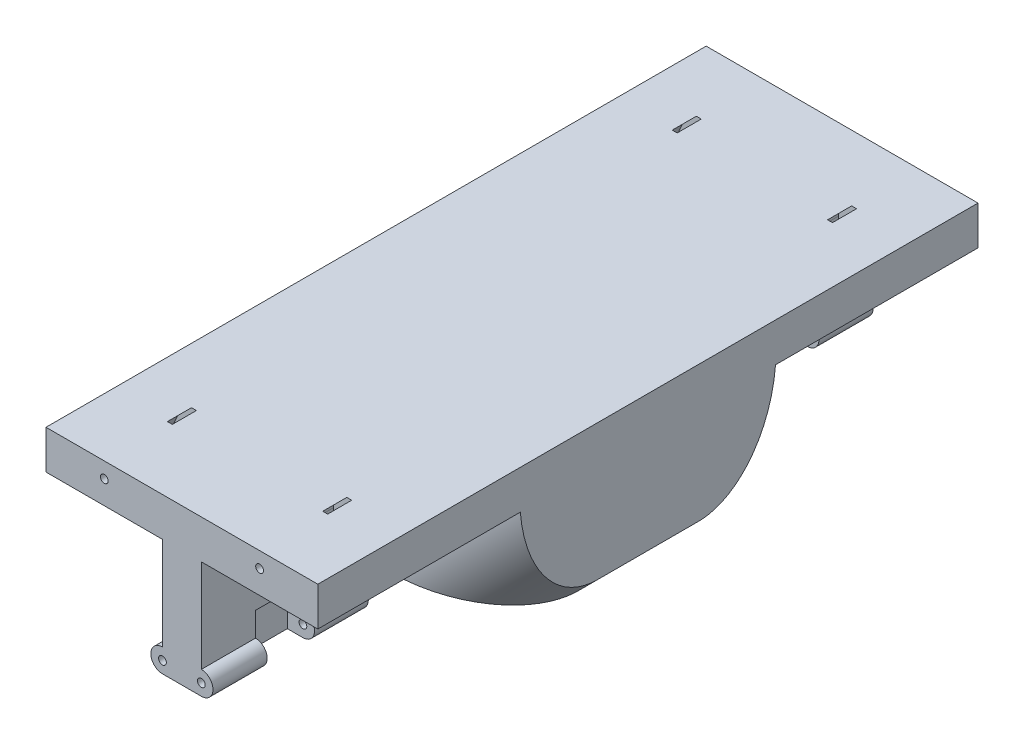
from build123d import *

# Parameters (mm, degrees)
SKETCH_1_W               = 70
SKETCH_1_H               = 40
EXTRUDE_1_DEPTH          = 85
SKETCH_7_W               = 30
SKETCH_7_H               = 30
CUT_EXTRUDE_5_DEPTH      = 52
SKETCH_4_R               = 3
EXTRUDE_3_DEPTH          = 40
SKETCH_5_W               = 12.2
SKETCH_5_H               = 12.2
CUT_EXTRUDE_3_DEPTH      = 4
SKETCH_6_R               = 1
CUT_EXTRUDE_4_DEPTH      = 40
MIRROR_2_COPY_1_SKETCH_W = 30
MIRROR_2_COPY_1_SKETCH_H = 30
MIRROR_2_COPY_1_DEPTH    = 52
MIRROR_2_COPY_2_SKETCH_R = 3
MIRROR_2_COPY_2_DEPTH    = 40
MIRROR_2_COPY_3_SKETCH_W = 12.2
MIRROR_2_COPY_3_SKETCH_H = 12.2
MIRROR_2_COPY_3_DEPTH    = 4
MIRROR_2_COPY_4_SKETCH_R = 1
MIRROR_2_COPY_4_DEPTH    = 40
MIRROR_2_COPY_5_SKETCH_W = 30
MIRROR_2_COPY_5_SKETCH_H = 30
MIRROR_2_COPY_5_DEPTH    = 52
MIRROR_2_COPY_6_SKETCH_R = 3
MIRROR_2_COPY_6_DEPTH    = 40
MIRROR_2_COPY_7_SKETCH_W = 12.2
MIRROR_2_COPY_7_SKETCH_H = 12.2
MIRROR_2_COPY_7_DEPTH    = 4
MIRROR_2_COPY_8_SKETCH_R = 1
MIRROR_2_COPY_8_DEPTH    = 40
CUT_EXTRUDE_8_REACH      = 126.742
SKETCH_13_R              = 1
CUT_EXTRUDE_11_DEPTH     = 40
SKETCH_14_R              = 1
CUT_EXTRUDE_12_DEPTH     = 3.1
FILLET_1_R               = 20
MIRROR_6_COPY_1_SKETCH_R = 1
MIRROR_6_COPY_1_DEPTH    = 40
MIRROR_6_COPY_2_SKETCH_R = 1
MIRROR_6_COPY_2_DEPTH    = 3.1


with BuildPart() as part:
    # Эскиз1 → Бобышка-Вытянуть1 (new, symmetric)
    with BuildSketch(Plane.XY):
        with Locations((0, -0.287208972)):
            Rectangle(SKETCH_1_W, SKETCH_1_H)
    extrude(amount=EXTRUDE_1_DEPTH, both=True)

    # Эскиз7 → Вырез-Вытянуть5 (cut)
    with BuildSketch(Plane.XY.offset(85)):
        with Locations((-20, -5.287208972)):
            Rectangle(SKETCH_7_W, SKETCH_7_H)
    cut_extrude_5 = extrude(amount=-CUT_EXTRUDE_5_DEPTH, mode=Mode.SUBTRACT)

    # Эскиз4 → Бобышка-Вытянуть3 (add)
    with BuildSketch(Plane.XY.offset(85)):
        with Locations((-5, -17.287208972)):
            Circle(SKETCH_4_R)
    extrude_3 = extrude(amount=-EXTRUDE_3_DEPTH)

    # Эскиз5 → Вырез-Вытянуть3 (cut, symmetric)
    with BuildSketch(Plane.ZY.offset(5)):
        with Locations((64.95, -14.187208972)):
            Rectangle(SKETCH_5_W, SKETCH_5_H)
    cut_extrude_3 = extrude(amount=CUT_EXTRUDE_3_DEPTH, both=True, mode=Mode.SUBTRACT)

    # Эскиз6 → Вырез-Вытянуть4 (cut)
    with BuildSketch(Plane.XY.offset(85)):
        with Locations((-5, -17.287208972)):
            Circle(SKETCH_6_R)
    cut_extrude_4 = extrude(amount=-CUT_EXTRUDE_4_DEPTH, mode=Mode.SUBTRACT)

    # Зеркальное отражение1: Вырез-Вытянуть5, Бобышка-Вытянуть3, Вырез-Вытянуть3, Вырез-Вытянуть4 across plane
    add(cut_extrude_5.mirror(Plane.XY), mode=Mode.SUBTRACT)
    add(extrude_3.mirror(Plane.XY))
    add(cut_extrude_3.mirror(Plane.XY), mode=Mode.SUBTRACT)
    add(cut_extrude_4.mirror(Plane.XY), mode=Mode.SUBTRACT)

    # Зеркальное отражение2 copy 1 sketch → Зеркальное отражение2 copy 1 (cut)
    with BuildSketch(Plane(origin=(0, 0, -85), x_dir=(-1, 0, 0), z_dir=(0, 0, -1))):
        with Locations((-20, -5.287208972)):
            Rectangle(MIRROR_2_COPY_1_SKETCH_W, MIRROR_2_COPY_1_SKETCH_H)
    extrude(amount=-MIRROR_2_COPY_1_DEPTH, mode=Mode.SUBTRACT)

    # Зеркальное отражение2 copy 2 sketch → Зеркальное отражение2 copy 2 (add)
    with BuildSketch(Plane(origin=(0, 0, -85), x_dir=(-1, 0, 0), z_dir=(0, 0, -1))):
        with Locations((-5, -17.287208972)):
            Circle(MIRROR_2_COPY_2_SKETCH_R)
    extrude(amount=-MIRROR_2_COPY_2_DEPTH)

    # Зеркальное отражение2 copy 3 sketch → Зеркальное отражение2 copy 3 (cut, symmetric)
    with BuildSketch(Plane(origin=(5, 0, 0), x_dir=(0, 0, -1), z_dir=(1, 0, 0))):
        with Locations((64.95, -14.187208972)):
            Rectangle(MIRROR_2_COPY_3_SKETCH_W, MIRROR_2_COPY_3_SKETCH_H)
    extrude(amount=MIRROR_2_COPY_3_DEPTH, both=True, mode=Mode.SUBTRACT)

    # Зеркальное отражение2 copy 4 sketch → Зеркальное отражение2 copy 4 (cut)
    with BuildSketch(Plane(origin=(0, 0, -85), x_dir=(-1, 0, 0), z_dir=(0, 0, -1))):
        with Locations((-5, -17.287208972)):
            Circle(MIRROR_2_COPY_4_SKETCH_R)
    extrude(amount=-MIRROR_2_COPY_4_DEPTH, mode=Mode.SUBTRACT)

    # Зеркальное отражение2 copy 5 sketch → Зеркальное отражение2 copy 5 (cut)
    with BuildSketch(Plane(origin=(0, 0, 85), x_dir=(-1, 0, 0), z_dir=(0, 0, 1))):
        with Locations((-20, 5.287208972)):
            Rectangle(MIRROR_2_COPY_5_SKETCH_W, MIRROR_2_COPY_5_SKETCH_H)
    extrude(amount=-MIRROR_2_COPY_5_DEPTH, mode=Mode.SUBTRACT)

    # Зеркальное отражение2 copy 6 sketch → Зеркальное отражение2 copy 6 (add)
    with BuildSketch(Plane(origin=(0, 0, 85), x_dir=(-1, 0, 0), z_dir=(0, 0, 1))):
        with Locations((-5, 17.287208972)):
            Circle(MIRROR_2_COPY_6_SKETCH_R)
    extrude(amount=-MIRROR_2_COPY_6_DEPTH)

    # Зеркальное отражение2 copy 7 sketch → Зеркальное отражение2 copy 7 (cut, symmetric)
    with BuildSketch(Plane(origin=(5, 0, 0), x_dir=(0, 0, 1), z_dir=(1, 0, 0))):
        with Locations((64.95, 14.187208972)):
            Rectangle(MIRROR_2_COPY_7_SKETCH_W, MIRROR_2_COPY_7_SKETCH_H)
    extrude(amount=MIRROR_2_COPY_7_DEPTH, both=True, mode=Mode.SUBTRACT)

    # Зеркальное отражение2 copy 8 sketch → Зеркальное отражение2 copy 8 (cut)
    with BuildSketch(Plane(origin=(0, 0, 85), x_dir=(-1, 0, 0), z_dir=(0, 0, 1))):
        with Locations((-5, 17.287208972)):
            Circle(MIRROR_2_COPY_8_SKETCH_R)
    extrude(amount=-MIRROR_2_COPY_8_DEPTH, mode=Mode.SUBTRACT)

    # Эскиз10 → Вырез-Вытянуть8 (cut, up to next)
    with BuildSketch(Plane.XY.offset(33), mode=Mode.PRIVATE) as cut_extrude_8_sk1:
        Polygon((35, -15.287208972), (30, -20.287208972), (35, -20.287208972), align=None)
    cut_extrude_8_tool1 = extrude(cut_extrude_8_sk1.sketch, amount=-CUT_EXTRUDE_8_REACH, mode=Mode.PRIVATE) & part.part
    # Эскиз10 → Вырез-Вытянуть8 (cut, up to next)
    with BuildSketch(Plane.XY.offset(33), mode=Mode.PRIVATE) as cut_extrude_8_sk2:
        Polygon((-30, -20.287208972), (-35, -15.287208972), (-35, -20.287208972), align=None)
    cut_extrude_8_tool2 = extrude(cut_extrude_8_sk2.sketch, amount=-CUT_EXTRUDE_8_REACH, mode=Mode.PRIVATE) & part.part
    add(cut_extrude_8_tool1.solids().sort_by_distance((33.333333, -18.620542, 33))[0], mode=Mode.SUBTRACT)
    add(cut_extrude_8_tool2.solids().sort_by_distance((-33.333333, -18.620542, 33))[0], mode=Mode.SUBTRACT)

    # Эскиз13 → Вырез-Вытянуть11 (cut)
    with BuildSketch(Plane.XY.offset(85)):
        with Locations((-20, 15.712791028)):
            Circle(SKETCH_13_R)
        with Locations((20, 15.712791028)):
            Circle(SKETCH_13_R)
    cut_extrude_11 = extrude(amount=-CUT_EXTRUDE_11_DEPTH, mode=Mode.SUBTRACT)

    # Эскиз14 → Вырез-Вытянуть12 (cut, symmetric)
    with BuildSketch(Plane.XY.offset(65)):
        with BuildLine():
            Line((-27, 9.712791028), (-15.95, 9.712791028))
            Line((-15.95, 9.712791028), (-15.95, 15.712791028))
            ThreePointArc((-15.95, 15.712791028), (-19.180771204, 19.679069407), (-23.718574904, 17.317378416))
            Line((-23.718574904, 17.317378416), (-27, 9.712791028))
        make_face()
        with Locations((-20, 15.712791028)):
            Circle(SKETCH_14_R, mode=Mode.SUBTRACT)
    cut_extrude_12 = extrude(amount=CUT_EXTRUDE_12_DEPTH, both=True, mode=Mode.SUBTRACT)

    # Скругление1
    fillet_1_edges = [part.edges().sort_by_distance(p)[0] for p in [
        (-32.5, -17.787208972, 33),
        (-32.5, -17.787208972, -33),
        (32.5, -17.787208972, 33),
        (32.5, -17.787208972, -33),
    ]]
    fillet(fillet_1_edges, radius=FILLET_1_R)

    # Зеркальное отражение5: Вырез-Вытянуть11, Вырез-Вытянуть12 across plane
    add(cut_extrude_11.mirror(Plane(origin=(0, 0, 0), x_dir=(0, 0, 1), z_dir=(1, 0, 0))), mode=Mode.SUBTRACT)
    add(cut_extrude_12.mirror(Plane(origin=(0, 0, 0), x_dir=(0, 0, 1), z_dir=(1, 0, 0))), mode=Mode.SUBTRACT)

    # Зеркальное отражение6: Вырез-Вытянуть11, Вырез-Вытянуть12 across plane
    add(cut_extrude_11.mirror(Plane.XY), mode=Mode.SUBTRACT)
    add(cut_extrude_12.mirror(Plane.XY), mode=Mode.SUBTRACT)

    # Зеркальное отражение6 copy 1 sketch → Зеркальное отражение6 copy 1 (cut)
    with BuildSketch(Plane(origin=(0, 0, -85), x_dir=(-1, 0, 0), z_dir=(0, 0, -1))):
        with Locations((-20, 15.712791028)):
            Circle(MIRROR_6_COPY_1_SKETCH_R)
        with Locations((20, 15.712791028)):
            Circle(MIRROR_6_COPY_1_SKETCH_R)
    extrude(amount=-MIRROR_6_COPY_1_DEPTH, mode=Mode.SUBTRACT)

    # Зеркальное отражение6 copy 2 sketch → Зеркальное отражение6 copy 2 (cut, symmetric)
    with BuildSketch(Plane(origin=(0, 0, -65), x_dir=(-1, 0, 0), z_dir=(0, 0, -1))):
        with BuildLine():
            Line((-27, 9.712791028), (-15.95, 9.712791028))
            Line((-15.95, 9.712791028), (-15.95, 15.712791028))
            ThreePointArc((-15.95, 15.712791028), (-19.180771204, 19.679069407), (-23.718574904, 17.317378416))
            Line((-23.718574904, 17.317378416), (-27, 9.712791028))
        make_face()
        with Locations((-20, 15.712791028)):
            Circle(MIRROR_6_COPY_2_SKETCH_R, mode=Mode.SUBTRACT)
    extrude(amount=MIRROR_6_COPY_2_DEPTH, both=True, mode=Mode.SUBTRACT)


solid = part.part
